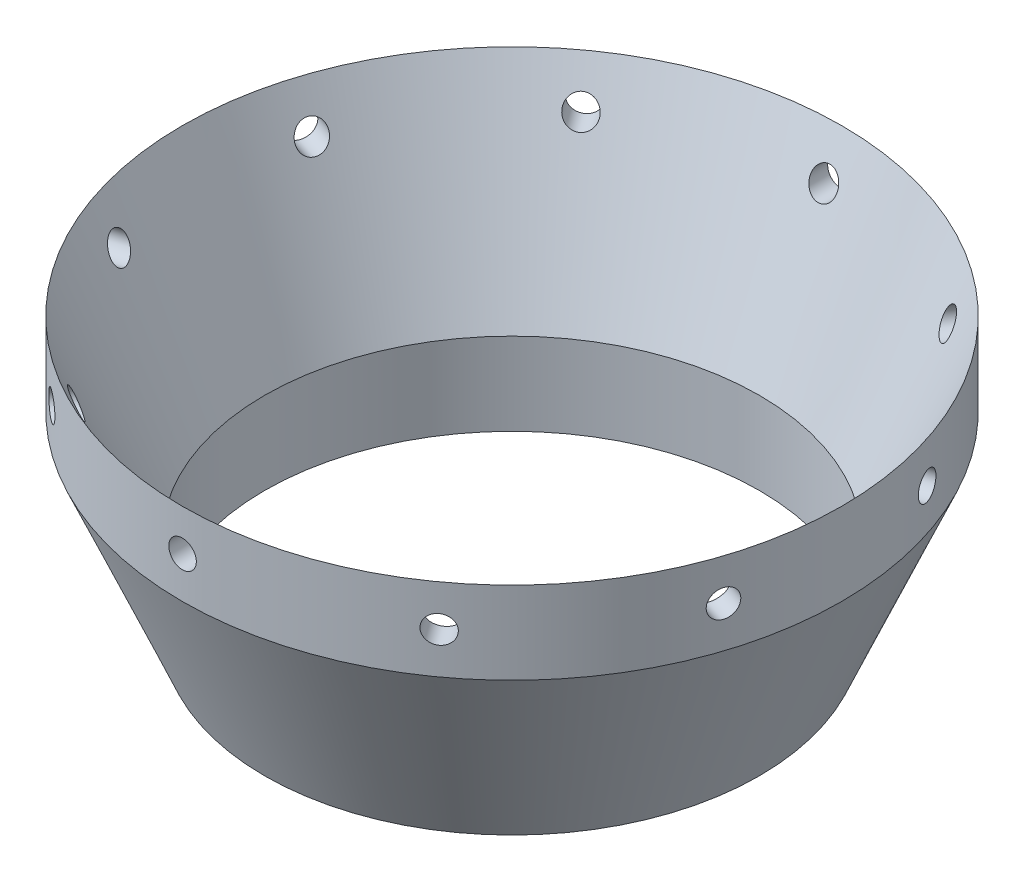
from build123d import *

# Parameters (mm, degrees)
SKETCH2_R          = 3.175
CUT_EXTRUDE1_DEPTH = 267.514272105
CIRPATTERN1_COUNT  = 10


with BuildPart() as part:
    # Sketch1 → Revolve1 (revolve)
    with BuildSketch(Plane.XY):
        Polygon((-57.15, 180.255978871), (-57.15, 199.305978871), (-76.2, 243.755978871), (-76.2, 224.705978871), align=None)
    revolve(axis=Axis((0, 0, 0), (0, 1, 0)))

    # Sketch2 → Cut-Extrude1 (cut, through all)
    with BuildSketch(Plane.XY):
        with Locations((0, 234.230978871)):
            Circle(SKETCH2_R)
    cut_extrude1 = extrude(amount=-CUT_EXTRUDE1_DEPTH, mode=Mode.SUBTRACT)

    # CirPattern1: Cut-Extrude1 ×10 about axis
    cirpattern1_axis = Axis((0, 235.80346447, 0), (0, -1, 0))
    for i in range(1, CIRPATTERN1_COUNT):
        add(cut_extrude1.rotate(cirpattern1_axis, i * 360 / CIRPATTERN1_COUNT), mode=Mode.SUBTRACT)


solid = part.part
